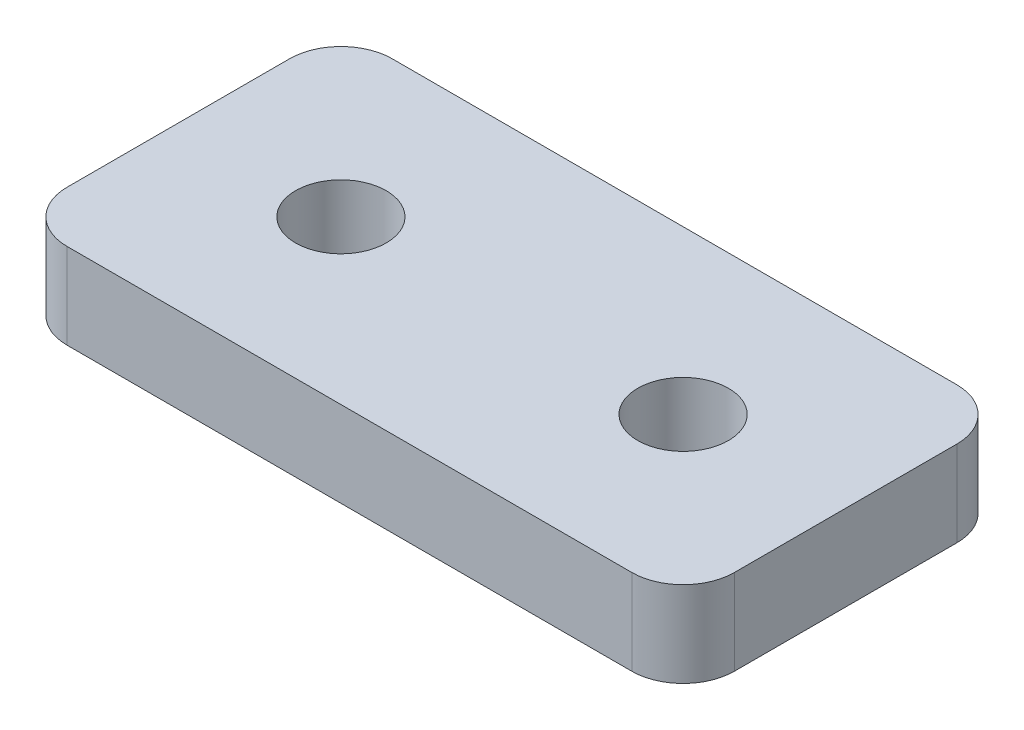
from build123d import *

# Parameters (mm, degrees)
F_2_HOLE_PROFILE_SKETCH_R = 2.65
F_2_HOLE_PROFILE_DEPTH    = 5


with BuildPart() as part:
    # 2 Hole Profile Sketch → 2 Hole Profile (new body)
    with BuildSketch(Plane(origin=(0, 0, 0), x_dir=(1, 0, 0), z_dir=(0, 1, 0))):
        with BuildLine():
            Line((-16.5, -9.5), (16.5, -9.5))
            ThreePointArc((16.5, -9.5), (18.621320344, -8.621320344), (19.5, -6.5))
            Line((19.5, -6.5), (19.5, 6.5))
            ThreePointArc((19.5, 6.5), (18.621320344, 8.621320344), (16.5, 9.5))
            Line((16.5, 9.5), (-16.5, 9.5))
            ThreePointArc((-16.5, 9.5), (-18.621320344, 8.621320344), (-19.5, 6.5))
            Line((-19.5, 6.5), (-19.5, -6.5))
            ThreePointArc((-19.5, -6.5), (-18.621320344, -8.621320344), (-16.5, -9.5))
        make_face()
        with Locations((-10, 0)):
            Circle(F_2_HOLE_PROFILE_SKETCH_R, mode=Mode.SUBTRACT)
        with Locations((10, 0)):
            Circle(F_2_HOLE_PROFILE_SKETCH_R, mode=Mode.SUBTRACT)
    extrude(amount=F_2_HOLE_PROFILE_DEPTH)


solid = part.part
